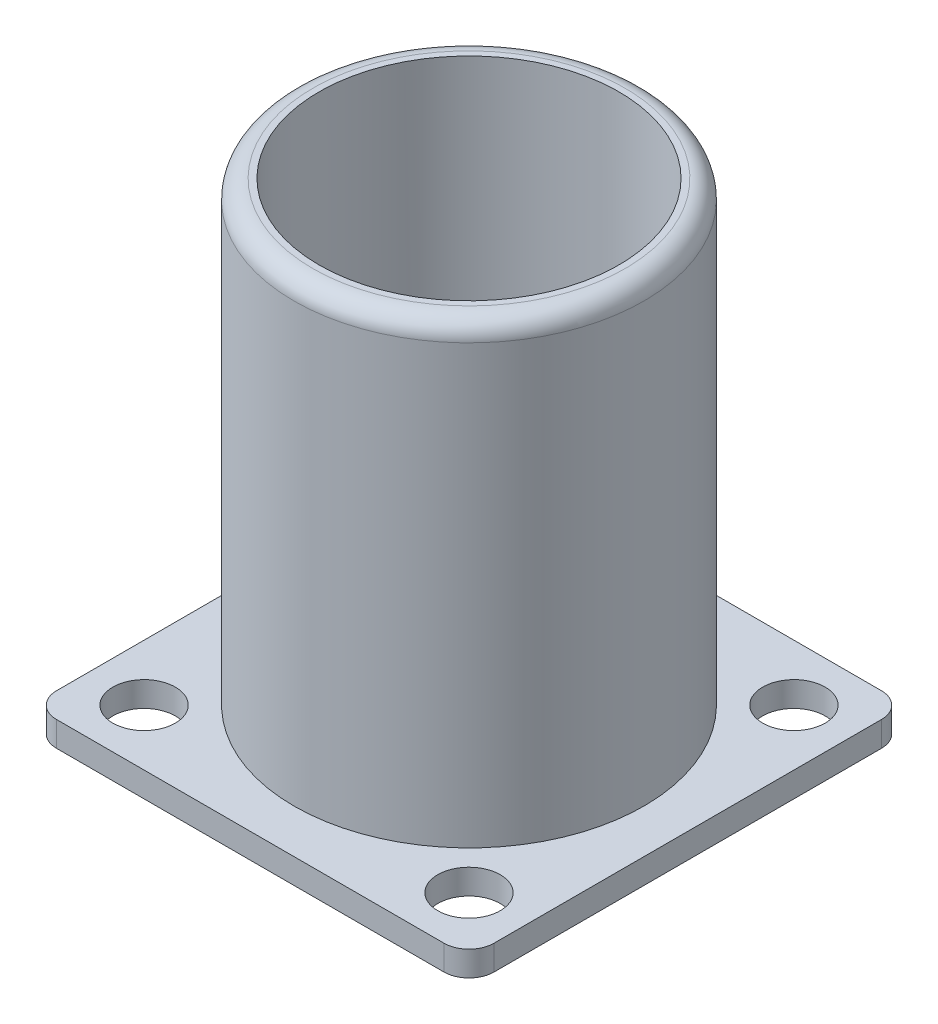
from build123d import *
from build123d.topology import SkipClean

# Parameters (mm, degrees)
ESBO_O1_W                = 35
ESBO_O1_H                = 35
RESSALTO_EXTRUS_O1_DEPTH = 2
FILETE2_R                = 2
ESBO_O3_R                = 14
ESBO_O3_R_2              = 12
RESSALTO_EXTRUS_O3_DEPTH = 36.5
FILETE3_R                = 1.5


with BuildPart() as part:
    # Esboço1 → Ressalto-extrusão1 (new body)
    with BuildSketch(Plane(origin=(0, 0, 0), x_dir=(1, 0, 0), z_dir=(0, 1, 0))):
        Rectangle(ESBO_O1_W, ESBO_O1_H)
        with BuildLine():
            ThreePointArc((-10.5, -13), (-15.304886114, -13.968245837), (-11.25, -11.214642893))
            ThreePointArc((-11.25, -11.214642893), (-10.695113886, -12.031754163), (-10.5, -13))
        make_face(mode=Mode.SUBTRACT)
        with BuildLine():
            ThreePointArc((15.5, -13), (12.031754163, -15.304886114), (11.25, -11.214642893))
            ThreePointArc((11.25, -11.214642893), (13.968245837, -10.695113886), (15.5, -13))
        make_face(mode=Mode.SUBTRACT)
        with BuildLine():
            ThreePointArc((-9.75, -6.99553429), (-10.59422921, -5.635805838), (-11.25, -4.175823272))
            Line((-11.25, -4.175823272), (-11.25, 4.175823272))
            ThreePointArc((-11.25, 4.175823272), (-10.59422921, 5.635805838), (-9.75, 6.99553429))
            Line((-9.75, 6.99553429), (-9.75, -6.99553429))
        make_face(mode=Mode.SUBTRACT)
        with BuildLine():
            ThreePointArc((-6.75, -9.921567416), (-7.524255874, -9.348025115), (-8.25, -8.714212529))
            Line((-8.25, -8.714212529), (-8.25, 8.714212529))
            ThreePointArc((-8.25, 8.714212529), (-7.524255874, 9.348025115), (-6.75, 9.921567416))
            Line((-6.75, 9.921567416), (-6.75, -9.921567416))
        make_face(mode=Mode.SUBTRACT)
        with BuildLine():
            ThreePointArc((-3.75, -11.399013115), (-4.510269977, -11.120137802), (-5.25, -10.790620927))
            Line((-5.25, -10.790620927), (-5.25, 10.790620927))
            ThreePointArc((-5.25, 10.790620927), (-4.510269977, 11.120137802), (-3.75, 11.399013115))
            Line((-3.75, 11.399013115), (-3.75, -11.399013115))
        make_face(mode=Mode.SUBTRACT)
        with BuildLine():
            Line((-0.75, 11.976539567), (-0.75, -11.976539567))
            ThreePointArc((-0.75, -11.976539567), (-1.502985267, -11.905504411), (-2.25, -11.787175234))
            Line((-2.25, -11.787175234), (-2.25, 11.787175234))
            ThreePointArc((-2.25, 11.787175234), (-1.502985267, 11.905504411), (-0.75, 11.976539567))
        make_face(mode=Mode.SUBTRACT)
        with BuildLine():
            ThreePointArc((-10.5, 13), (-10.695113886, 12.031754163), (-11.25, 11.214642893))
            ThreePointArc((-11.25, 11.214642893), (-15.304886114, 13.968245837), (-10.5, 13))
        make_face(mode=Mode.SUBTRACT)
        with BuildLine():
            ThreePointArc((2.25, -11.787175234), (1.502985267, -11.905504411), (0.75, -11.976539567))
            Line((0.75, -11.976539567), (0.75, 11.976539567))
            ThreePointArc((0.75, 11.976539567), (1.502985267, 11.905504411), (2.25, 11.787175234))
            Line((2.25, 11.787175234), (2.25, -11.787175234))
        make_face(mode=Mode.SUBTRACT)
        with BuildLine():
            ThreePointArc((5.25, -10.790620927), (4.510269977, -11.120137802), (3.75, -11.399013115))
            Line((3.75, -11.399013115), (3.75, 11.399013115))
            ThreePointArc((3.75, 11.399013115), (4.510269977, 11.120137802), (5.25, 10.790620927))
            Line((5.25, 10.790620927), (5.25, -10.790620927))
        make_face(mode=Mode.SUBTRACT)
        with BuildLine():
            ThreePointArc((8.25, -8.714212529), (7.524255874, -9.348025115), (6.75, -9.921567416))
            Line((6.75, -9.921567416), (6.75, 9.921567416))
            ThreePointArc((6.75, 9.921567416), (7.524255874, 9.348025115), (8.25, 8.714212529))
            Line((8.25, 8.714212529), (8.25, -8.714212529))
        make_face(mode=Mode.SUBTRACT)
        with BuildLine():
            ThreePointArc((11.25, -4.175823272), (10.59422921, -5.635805838), (9.75, -6.99553429))
            Line((9.75, -6.99553429), (9.75, 6.99553429))
            ThreePointArc((9.75, 6.99553429), (10.59422921, 5.635805838), (11.25, 4.175823272))
            Line((11.25, 4.175823272), (11.25, -4.175823272))
        make_face(mode=Mode.SUBTRACT)
        with BuildLine():
            ThreePointArc((15.5, 13), (13.968245837, 10.695113886), (11.25, 11.214642893))
            ThreePointArc((11.25, 11.214642893), (12.031754163, 15.304886114), (15.5, 13))
        make_face(mode=Mode.SUBTRACT)
    extrude(amount=RESSALTO_EXTRUS_O1_DEPTH)

    # Filete2
    filete2_edges = [part.edges().sort_by_distance(p)[0] for p in [
        (-17.5, 1, 17.5),
        (17.5, 1, 17.5),
        (17.5, 1, -17.5),
        (-17.5, 1, -17.5),
    ]]
    fillet(filete2_edges, radius=FILETE2_R)

    # Esboço3 → Ressalto-extrusão3 (add)
    with SkipClean():  # the faces are left unmerged after this step: merging them gives an invalid solid
        with BuildSketch(Plane(origin=(0, 2, 0), x_dir=(1, 0, 0), z_dir=(0, 1, 0))):
            Circle(ESBO_O3_R)
            Circle(ESBO_O3_R_2, mode=Mode.SUBTRACT)
        extrude(amount=RESSALTO_EXTRUS_O3_DEPTH)

    # Filete3
    filete3_edges = [part.edges().sort_by_distance(p)[0] for p in [
        (-14, 38.5, 0),
    ]]
    fillet(filete3_edges, radius=FILETE3_R)


solid = part.part
